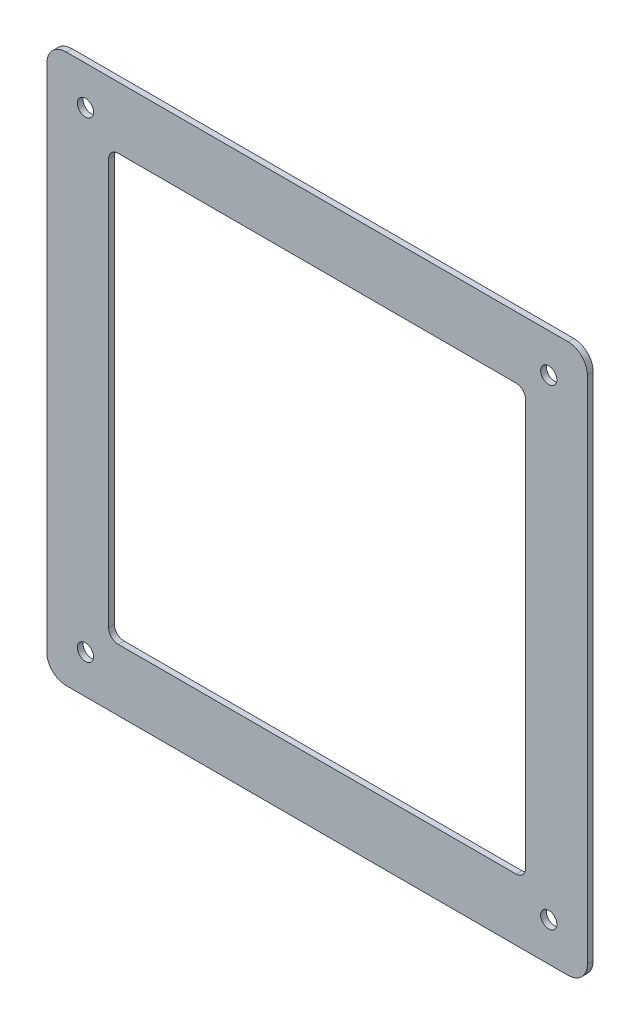
from build123d import *

# Parameters (mm, degrees)
SKETCH_1_W              = 280
SKETCH_1_H              = 284.25
SKETCH_1_W_2            = 216
SKETCH_1_H_2            = 220.25
EXTRUDE_1_DEPTH         = 3
FILLET_1_R              = 10
FILLET_2_R              = 5
HOLE_WIZARD_8_4_8_4_1_D = 8.4


with BuildPart() as part:
    # 草图1 → 凸台-拉伸1 (new body)
    with BuildSketch(Plane.XY):
        Rectangle(SKETCH_1_W, SKETCH_1_H)
        Rectangle(SKETCH_1_W_2, SKETCH_1_H_2, mode=Mode.SUBTRACT)
    extrude(amount=EXTRUDE_1_DEPTH)

    # 圆角1
    fillet_1_edges = [part.edges().sort_by_distance(p)[0] for p in [
        (140, 142.125, 1.5),
        (140, -142.125, 1.5),
        (-140, -142.125, 1.5),
        (-140, 142.125, 1.5),
    ]]
    fillet(fillet_1_edges, radius=FILLET_1_R)

    # 圆角2
    fillet_2_edges = [part.edges().sort_by_distance(p)[0] for p in [
        (-108, 110.125, 1.5),
        (-108, -110.125, 1.5),
        (108, -110.125, 1.5),
        (108, 110.125, 1.5),
    ]]
    fillet(fillet_2_edges, radius=FILLET_2_R)

    # Ø8.4 (8.4) 直径孔1 (through all)
    with Locations(Plane.XY.offset(3)):
        with Locations((120, -122.125), (-120, 122.125), (-120, -122.125), (120, 122.125)):
            Hole(HOLE_WIZARD_8_4_8_4_1_D / 2)


solid = part.part
